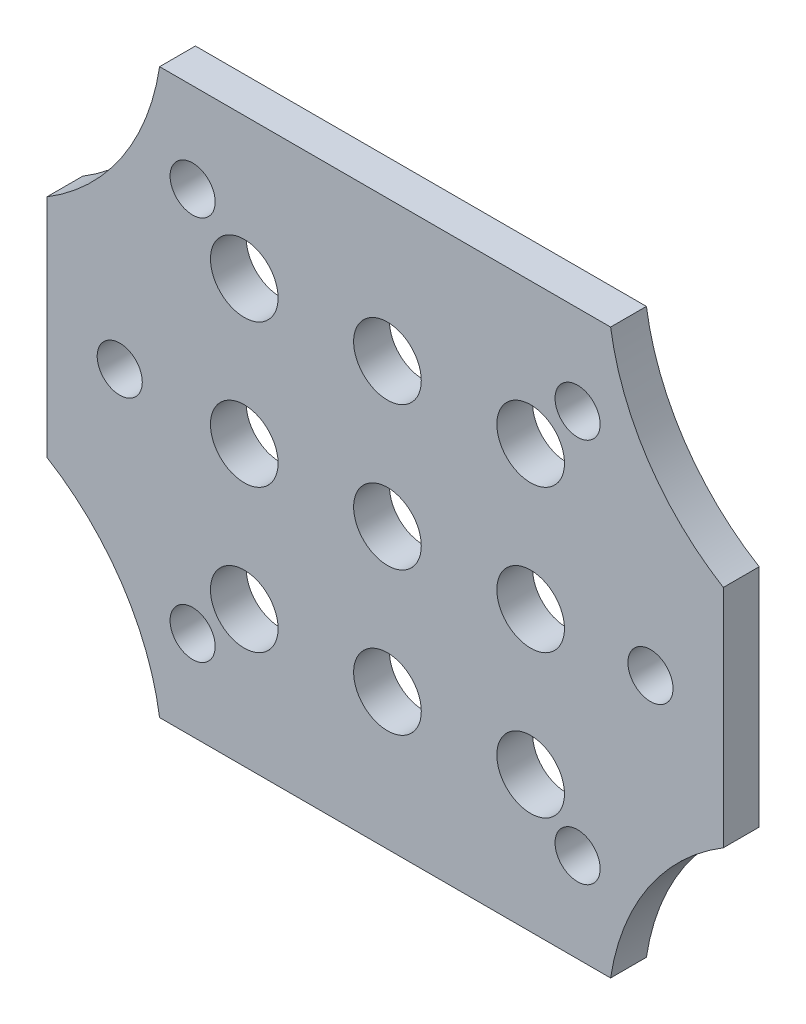
from build123d import *

# Parameters (mm, degrees)
SKETCH1_W                 = 60
SKETCH1_H                 = 50
BOSS_EXTRUDE1_DEPTH       = 3.175
SKETCH2_R                 = 2
CUT_EXTRUDE1_DEPTH        = 6.35
SKETCH3_R                 = 3
CUT_EXTRUDE2_DEPTH        = 40.180104964
LPATTERN1_COUNT           = 3
LPATTERN1_PITCH           = 12.7
LPATTERN2_COPY_1_SKETCH_R = 3
LPATTERN2_COPY_1_DEPTH    = 40.180104964
LPATTERN2_COPY_2_SKETCH_R = 3
LPATTERN2_COPY_2_DEPTH    = 40.180104964
LPATTERN2_COPY_3_SKETCH_R = 3
LPATTERN2_COPY_3_DEPTH    = 40.180104964
LPATTERN2_COPY_4_SKETCH_R = 3
LPATTERN2_COPY_4_DEPTH    = 40.180104964
LPATTERN2_COPY_5_SKETCH_R = 3
LPATTERN2_COPY_5_DEPTH    = 40.180104964
LPATTERN2_COPY_6_SKETCH_R = 3
LPATTERN2_COPY_6_DEPTH    = 40.180104964


with BuildPart() as part:
    # Sketch1 → Boss-Extrude1 (new body)
    with BuildSketch(Plane.XY):
        Rectangle(SKETCH1_W, SKETCH1_H)
    extrude(amount=BOSS_EXTRUDE1_DEPTH)

    # Sketch2 → Cut-Extrude1 (cut)
    with BuildSketch(Plane.XY.offset(3.175)):
        with Locations((-17.07106781, 17.07106781)):
            Circle(SKETCH2_R)
        with Locations((17.07106781, 17.07106781)):
            Circle(SKETCH2_R)
        with Locations((-17.07106781, -17.07106781)):
            Circle(SKETCH2_R)
        with Locations((17.07106781, -17.07106781)):
            Circle(SKETCH2_R)
        with Locations((-23.535533905, 0)):
            Circle(SKETCH2_R)
        with Locations((23.535533905, 0)):
            Circle(SKETCH2_R)
        with BuildLine():
            Line((-30, 25), (-30, 10))
            ThreePointArc((-30, 10), (-23.335411727, 16.390274485), (-20, 25))
            Line((-20, 25), (-30, 25))
        make_face()
        with BuildLine():
            ThreePointArc((-20, -25), (-23.335411727, -16.390274485), (-30, -10))
            Line((-30, -10), (-30, -25))
            Line((-30, -25), (-20, -25))
        make_face()
        with BuildLine():
            Line((30, 25), (20, 25))
            ThreePointArc((20, 25), (23.335411727, 16.390274485), (30, 10))
            Line((30, 10), (30, 25))
        make_face()
        with BuildLine():
            ThreePointArc((30, -10), (23.335411727, -16.390274485), (20, -25))
            Line((20, -25), (30, -25))
            Line((30, -25), (30, -10))
        make_face()
    extrude(amount=-CUT_EXTRUDE1_DEPTH, mode=Mode.SUBTRACT)

    # Sketch3 → Cut-Extrude2 (cut, through all)
    with BuildSketch(Plane.XY.offset(3.175)):
        with Locations((-12.490915526, 12.490915526)):
            Circle(SKETCH3_R)
    cut_extrude2 = extrude(amount=-CUT_EXTRUDE2_DEPTH, mode=Mode.SUBTRACT)

    # LPattern1: Cut-Extrude2 ×3
    with Locations(*[(i * LPATTERN1_PITCH, 0, 0) for i in range(1, LPATTERN1_COUNT)]):
        add(cut_extrude2, mode=Mode.SUBTRACT)

    # LPattern2 copy 1 sketch → LPattern2 copy 1 (cut, through all)
    with BuildSketch(Plane(origin=(12.7, -12.7, 3.175), x_dir=(1, 0, 0), z_dir=(0, 0, 1))):
        with Locations((-12.490915526, 12.490915526)):
            Circle(LPATTERN2_COPY_1_SKETCH_R)
    extrude(amount=-LPATTERN2_COPY_1_DEPTH, mode=Mode.SUBTRACT)

    # LPattern2 copy 2 sketch → LPattern2 copy 2 (cut, through all)
    with BuildSketch(Plane(origin=(12.7, -25.4, 3.175), x_dir=(1, 0, 0), z_dir=(0, 0, 1))):
        with Locations((-12.490915526, 12.490915526)):
            Circle(LPATTERN2_COPY_2_SKETCH_R)
    extrude(amount=-LPATTERN2_COPY_2_DEPTH, mode=Mode.SUBTRACT)

    # LPattern2 copy 3 sketch → LPattern2 copy 3 (cut, through all)
    with BuildSketch(Plane(origin=(25.4, -12.7, 3.175), x_dir=(1, 0, 0), z_dir=(0, 0, 1))):
        with Locations((-12.490915526, 12.490915526)):
            Circle(LPATTERN2_COPY_3_SKETCH_R)
    extrude(amount=-LPATTERN2_COPY_3_DEPTH, mode=Mode.SUBTRACT)

    # LPattern2 copy 4 sketch → LPattern2 copy 4 (cut, through all)
    with BuildSketch(Plane(origin=(25.4, -25.4, 3.175), x_dir=(1, 0, 0), z_dir=(0, 0, 1))):
        with Locations((-12.490915526, 12.490915526)):
            Circle(LPATTERN2_COPY_4_SKETCH_R)
    extrude(amount=-LPATTERN2_COPY_4_DEPTH, mode=Mode.SUBTRACT)

    # LPattern2 copy 5 sketch → LPattern2 copy 5 (cut, through all)
    with BuildSketch(Plane(origin=(0, -12.7, 3.175), x_dir=(1, 0, 0), z_dir=(0, 0, 1))):
        with Locations((-12.490915526, 12.490915526)):
            Circle(LPATTERN2_COPY_5_SKETCH_R)
    extrude(amount=-LPATTERN2_COPY_5_DEPTH, mode=Mode.SUBTRACT)

    # LPattern2 copy 6 sketch → LPattern2 copy 6 (cut, through all)
    with BuildSketch(Plane(origin=(0, -25.4, 3.175), x_dir=(1, 0, 0), z_dir=(0, 0, 1))):
        with Locations((-12.490915526, 12.490915526)):
            Circle(LPATTERN2_COPY_6_SKETCH_R)
    extrude(amount=-LPATTERN2_COPY_6_DEPTH, mode=Mode.SUBTRACT)


solid = part.part
